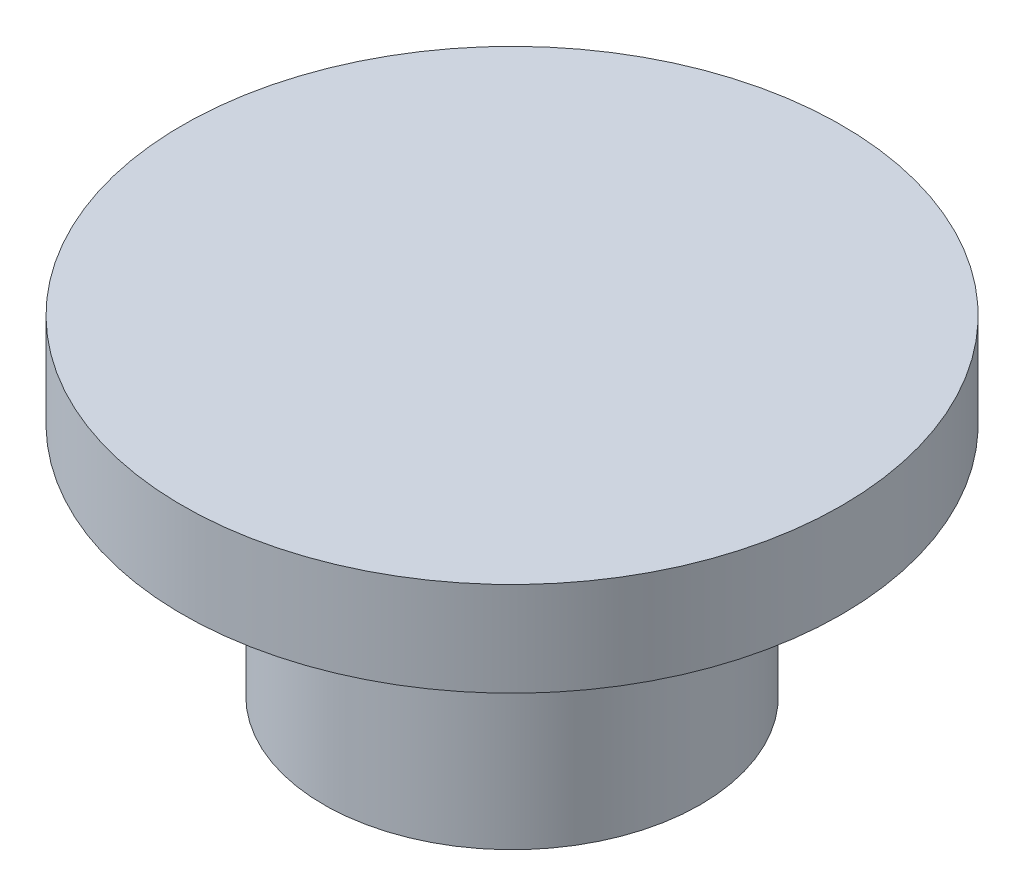
from build123d import *

# Parameters (mm, degrees)
SHELL1_OUTLINE_R = 15
SHELL1_DEPTH     = 30


# Read off the part's stored shape, not the designer's step: Shell1
with BuildPart() as part:
    # Sketch1 → Revolve1 (revolve)
    with BuildSketch(Plane.XY):
        Polygon((0, 35), (35, 35), (35, 25), (20, 25), (20, 0), (0, 0), align=None)
    revolve(axis=Axis((0, 0, 0), (0, 1, 0)))

    # Shell1 outline → Shell1 (cut)
    with BuildSketch(Plane(origin=(0, 0, 0), x_dir=(1, 0, 0), z_dir=(0, 1, 0))):
        Circle(SHELL1_OUTLINE_R)
    extrude(amount=SHELL1_DEPTH, mode=Mode.SUBTRACT)


solid = part.part
